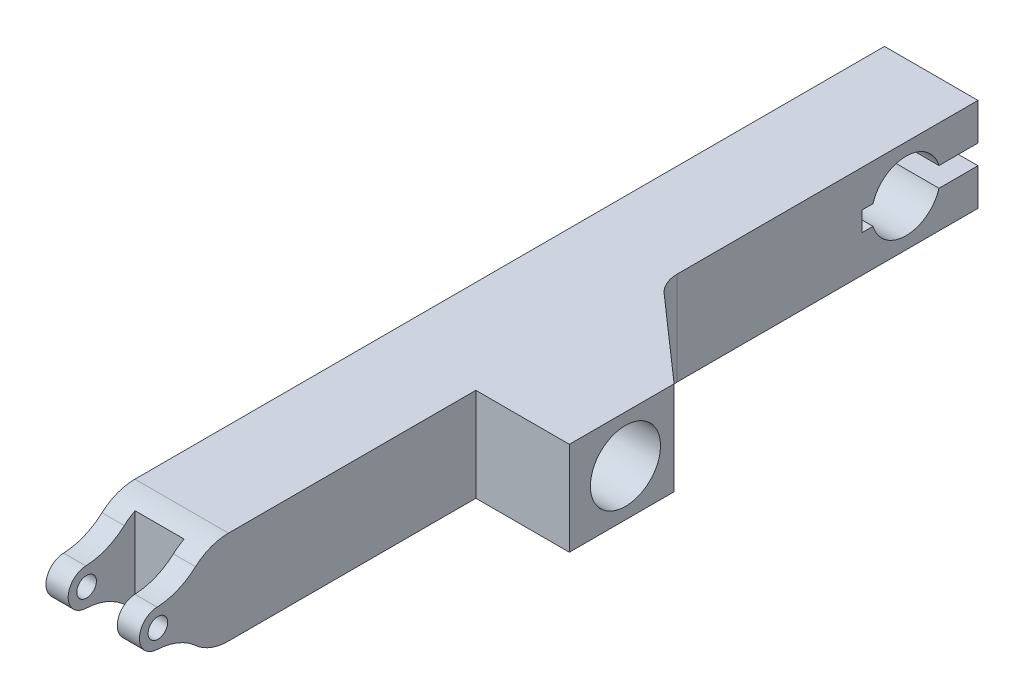
from build123d import *

# Parameters (mm, degrees)
SKETCH1_R           = 14.2875
BOSS_EXTRUDE1_DEPTH = 38.1
SKETCH2_W           = 76.2
SKETCH2_H           = 38.1
SKETCH2_R           = 14.2875
BOSS_EXTRUDE2_DEPTH = 38.1
CUT_EXTRUDE1_DEPTH  = 38.1
FILLET1_R           = 12.7
SKETCH4_W           = 38.1
SKETCH4_H           = 38.1
BOSS_EXTRUDE3_DEPTH = 152.4
SKETCH5_R           = 4
CUT_EXTRUDE2_DEPTH  = 152.4
SKETCH6_W           = 20
SKETCH6_H           = 54.519891076
CUT_EXTRUDE3_DEPTH  = 152.4


with BuildPart() as part:
    # Sketch1 → Boss-Extrude1 (new body)
    with BuildSketch(Plane(origin=(0, 0, 0), x_dir=(0, 0, -1), z_dir=(1, 0, 0))):
        with BuildLine():
            Line((29.337186502, -19.05), (-175.255687154, -19.05))
            Line((-175.255687154, -19.05), (-175.255687154, 19.05))
            Line((-175.255687154, 19.05), (29.337186502, 19.05))
            Line((29.337186502, 19.05), (29.337186502, 4))
            Line((29.337186502, 4), (13.442493258, 4))
            ThreePointArc((13.442493258, 4), (0, 14.025), (-13.442493258, 4))
            Line((-13.442493258, 4), (-18.025, 4))
            Line((-18.025, 4), (-18.025, -4))
            Line((-18.025, -4), (-13.442493258, -4))
            ThreePointArc((-13.442493258, -4), (0, -14.025), (13.442493258, -4))
            Line((13.442493258, -4), (29.337186502, -4))
            Line((29.337186502, -4), (29.337186502, -19.05))
        make_face()
        with Locations((-152.4, 0)):
            Circle(SKETCH1_R, mode=Mode.SUBTRACT)
    extrude(amount=BOSS_EXTRUDE1_DEPTH)

    # Sketch2 → Boss-Extrude2 (add)
    with BuildSketch(Plane(origin=(38.1, 0, 0), x_dir=(0, 0, -1), z_dir=(1, 0, 0))):
        with Locations((-137.155687154, 0)):
            Rectangle(SKETCH2_W, SKETCH2_H)
        with Locations((-152.4, 0)):
            Circle(SKETCH2_R, mode=Mode.SUBTRACT)
    extrude(amount=BOSS_EXTRUDE2_DEPTH)

    # Sketch3 → Cut-Extrude1 (cut)
    with BuildSketch(Plane(origin=(0, 19.05, 0), x_dir=(1, 0, 0), z_dir=(0, 1, 0))):
        Polygon((38.1, -99.055687154), (76.2, -132.562404594), (94.277321555, -84.449227978), align=None)
    extrude(amount=-CUT_EXTRUDE1_DEPTH, mode=Mode.SUBTRACT)

    # Fillet1
    fillet1_edges = [part.edges().sort_by_distance(p)[0] for p in [
        (38.1, 0, 99.055687154),
    ]]
    fillet(fillet1_edges, radius=FILLET1_R)

    # Sketch4 → Boss-Extrude3 (add)
    with BuildSketch(Plane.XY.offset(175.255687154)):
        with Locations((19.05, 0)):
            Rectangle(SKETCH4_W, SKETCH4_H)
    extrude(amount=BOSS_EXTRUDE3_DEPTH)

    # Sketch5 → Cut-Extrude2 (cut)
    with BuildSketch(Plane.ZY):
        with BuildLine():
            ThreePointArc((289.902590337, -13.487367982), (283.520288655, -17.607307989), (276.061983206, -19.05))
            Line((276.061983206, -19.05), (276.061983206, -31.426856949))
            Line((276.061983206, -31.426856949), (335.038222157, -31.426856949))
            Line((335.038222157, -31.426856949), (335.038222157, 26.741787919))
            Line((335.038222157, 26.741787919), (276.061983206, 26.741787919))
            Line((276.061983206, 26.741787919), (276.061983206, 19.05))
            ThreePointArc((276.061983206, 19.05), (283.23601937, 17.719044033), (289.455222911, 13.903320511))
            ThreePointArc((289.455222911, 13.903320511), (296.729713738, 9.331803599), (305.122332125, 7.493070265))
            ThreePointArc((305.122332125, 7.493070265), (312.299999345, -0.003133554), (305.116070696, -7.493336995))
            ThreePointArc((305.116070696, -7.493336995), (297.005412671, -9.211356056), (289.902590337, -13.487367982))
        make_face()
        with Locations((304.8, 0)):
            Circle(SKETCH5_R)
    extrude(amount=-CUT_EXTRUDE2_DEPTH, mode=Mode.SUBTRACT)

    # Sketch6 → Cut-Extrude3 (cut)
    with BuildSketch(Plane.XZ.offset(19.05)):
        with Locations((19.05, 312.3)):
            Rectangle(SKETCH6_W, SKETCH6_H)
    extrude(amount=-CUT_EXTRUDE3_DEPTH, mode=Mode.SUBTRACT)


solid = part.part
